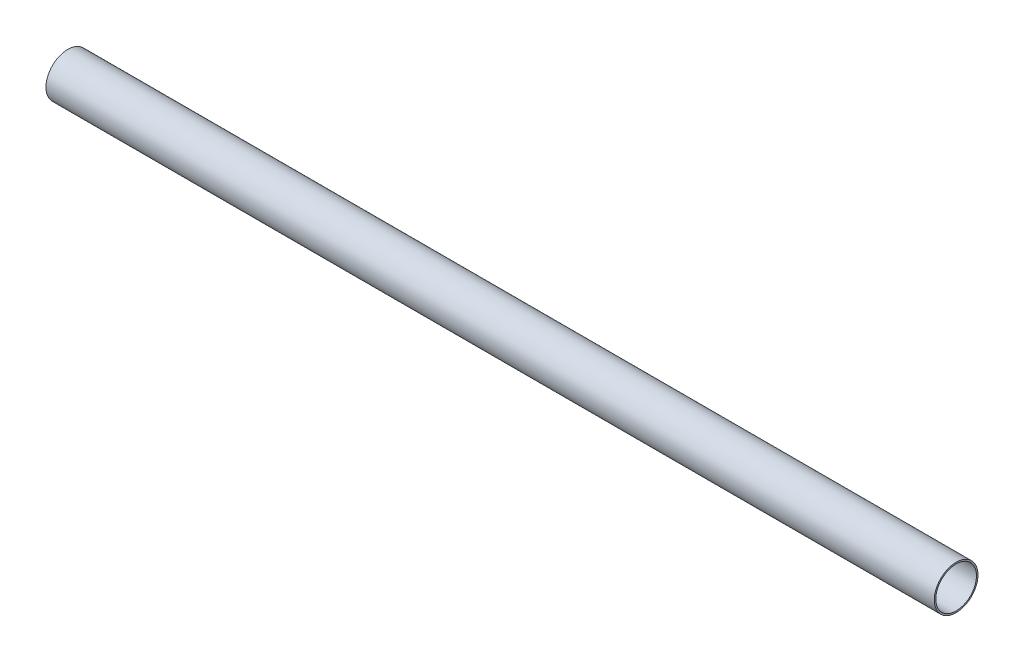
from build123d import *

# Parameters (mm, degrees)
SKETCH1_R           = 12.7
SKETCH1_R_2         = 11.811
BOSS_EXTRUDE1_DEPTH = 516


with BuildPart() as part:
    # Sketch1 → Boss-Extrude1 (new body)
    with BuildSketch(Plane(origin=(0, 0, 0), x_dir=(0, 0, -1), z_dir=(1, 0, 0))):
        Circle(SKETCH1_R)
        Circle(SKETCH1_R_2, mode=Mode.SUBTRACT)
    extrude(amount=BOSS_EXTRUDE1_DEPTH)


solid = part.part
